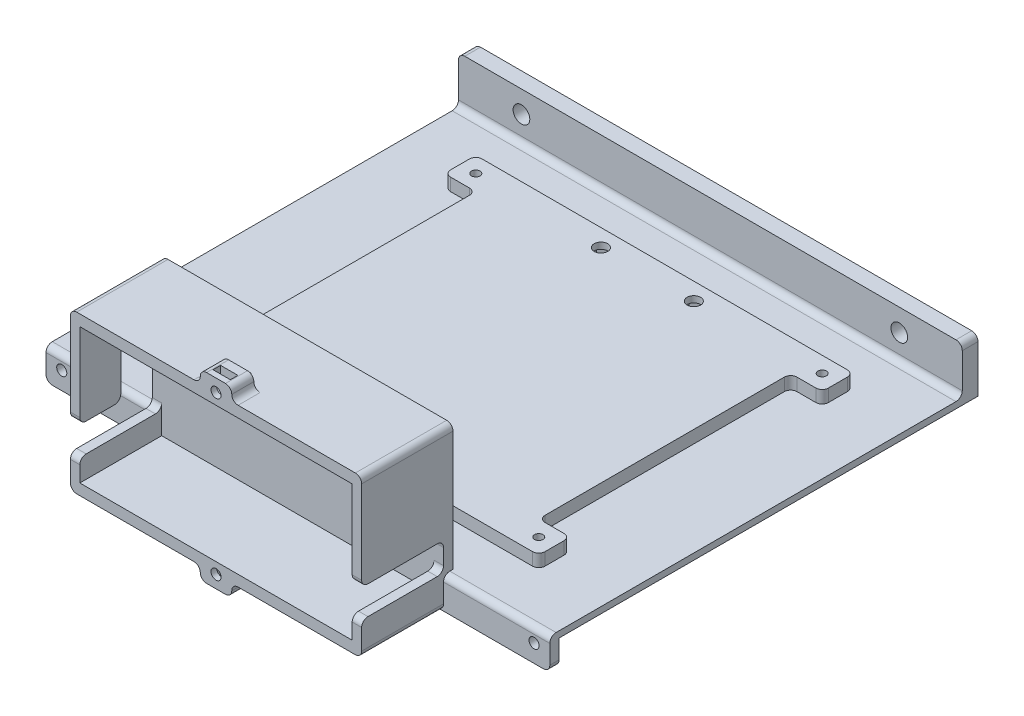
from build123d import *

# Parameters (mm, degrees)
SKETCH1_W                      = 160
SKETCH1_H                      = 133
BOSS_EXTRUDE1_DEPTH            = 2
SKETCH2_W                      = 160
SKETCH2_H                      = 10
BOSS_EXTRUDE2_DEPTH            = 3
M3_CLEARANCE_HOLE1_D           = 3.2
M3_CLEARANCE_HOLE1_DEPTH       = 12.4
M3_CLEARANCE_HOLE1_TIP         = 0.96137699
SKETCH5_W                      = 160
SKETCH5_H                      = 15
BOSS_EXTRUDE3_DEPTH            = 5
M5_CLEARANCE_HOLE1_D           = 5.3
M5_CLEARANCE_HOLE1_DEPTH       = 12.4
M5_CLEARANCE_HOLE1_TIP         = 1.59228064
BOSS_EXTRUDE4_DEPTH            = 4
M2_5_CLEARANCE_HOLE1_D         = 2.7
M4_CLEARANCE_HOLE1_D           = 4.3
CUT_EXTRUDE4_DEPTH             = 4
SKETCH13_W                     = 92.5
SKETCH13_H                     = 29
BOSS_EXTRUDE5_DEPTH            = 50
SKETCH14_W                     = 86.5
SKETCH14_H                     = 43
CUT_EXTRUDE1_DEPTH             = 26
SKETCH15_W                     = 10
SKETCH15_H                     = 4
BOSS_EXTRUDE6_DEPTH            = 7
F_3_2_3_2_DIAMETER_HOLE1_D     = 3.2
F_3_2_3_2_DIAMETER_HOLE1_DEPTH = 10
F_3_2_3_2_DIAMETER_HOLE1_TIP   = 0.96137699
CUT_EXTRUDE2_DEPTH             = 26
SKETCH21_W                     = 13
SKETCH21_H                     = 21
BOSS_EXTRUDE7_DEPTH            = 3
CUT_EXTRUDE3_DEPTH             = 1.2
FILLET1_R                      = 2


with BuildPart() as part:
    # Sketch1 → Boss-Extrude1 (new body)
    with BuildSketch(Plane(origin=(0, 0, 0), x_dir=(1, 0, 0), z_dir=(0, 1, 0))):
        Rectangle(SKETCH1_W, SKETCH1_H)
    extrude(amount=BOSS_EXTRUDE1_DEPTH)

    # Sketch2 → Boss-Extrude2 (add)
    with BuildSketch(Plane.XY.offset(66.5)):
        with Locations((0, -3)):
            Rectangle(SKETCH2_W, SKETCH2_H)
    extrude(amount=BOSS_EXTRUDE2_DEPTH)

    # M3 Clearance Hole1
    with Locations(Plane.XY.offset(69.5)):
        with Locations((-75, -2.38), (75, -2.38)):
            Hole(M3_CLEARANCE_HOLE1_D / 2, depth=M3_CLEARANCE_HOLE1_DEPTH)
            with Locations((0, 0, -(M3_CLEARANCE_HOLE1_DEPTH + M3_CLEARANCE_HOLE1_TIP / 2))):  # 118° drill point
                Cone(0, M3_CLEARANCE_HOLE1_D / 2, M3_CLEARANCE_HOLE1_TIP, mode=Mode.SUBTRACT)

    # Sketch5 → Boss-Extrude3 (add)
    with BuildSketch(Plane(origin=(0, 0, -66.5), x_dir=(-1, 0, 0), z_dir=(0, 0, -1))):
        with Locations((0, 9.5)):
            Rectangle(SKETCH5_W, SKETCH5_H)
    extrude(amount=-BOSS_EXTRUDE3_DEPTH)

    # M5 Clearance Hole1
    with Locations(Plane.XY.offset(-61.5)):
        with Locations((60, 10), (-60, 10)):
            Hole(M5_CLEARANCE_HOLE1_D / 2, depth=M5_CLEARANCE_HOLE1_DEPTH)
            with Locations((0, 0, -(M5_CLEARANCE_HOLE1_DEPTH + M5_CLEARANCE_HOLE1_TIP / 2))):  # 118° drill point
                Cone(0, M5_CLEARANCE_HOLE1_D / 2, M5_CLEARANCE_HOLE1_TIP, mode=Mode.SUBTRACT)

    # Sketch8 → Boss-Extrude4 (add)
    with BuildSketch(Plane(origin=(0, 2, 0), x_dir=(1, 0, 0), z_dir=(0, 1, 0))):
        Polygon((-50, 37), (-50, -43), (-60, -43), (-60, -53), (-50, -53), (50, -53), (60, -53), (60, -43), (50, -43), (50, 37), (60, 37), (60, 47), (50, 47), (-50, 47), (-60, 47), (-60, 37), align=None)
    extrude(amount=BOSS_EXTRUDE4_DEPTH)

    # M2.5 Clearance Hole1 (through all)
    with Locations(Plane(origin=(0, 6, 0), x_dir=(1, 0, 0), z_dir=(0, 1, 0))):
        with Locations((-55, 42), (55, 42), (55, -48), (-55, -48)):
            Hole(M2_5_CLEARANCE_HOLE1_D / 2)

    # M4 Clearance Hole1 (through all)
    with Locations(Plane(origin=(0, 6, 0), x_dir=(1, 0, 0), z_dir=(0, 1, 0))):
        with Locations((-14.75, 41.5), (14.75, 41.5), (-14.75, -47.5), (14.75, -47.5)):
            Hole(M4_CLEARANCE_HOLE1_D / 2)

    # Sketch25 → Cut-Extrude4 (cut)
    with BuildSketch(Plane(origin=(0, 0, 0), x_dir=(-1, 0, 0), z_dir=(0, -1, 0))):
        Polygon((55, -50.886751346), (57.5, -49.443375673), (57.5, -46.556624327), (55, -45.113248654), (52.5, -46.556624327), (52.5, -49.443375673), align=None)
        Polygon((-55, -50.886751346), (-52.5, -49.443375673), (-52.5, -46.556624327), (-55, -45.113248654), (-57.5, -46.556624327), (-57.5, -49.443375673), align=None)
        Polygon((-55, 39.113248654), (-52.5, 40.556624327), (-52.5, 43.443375673), (-55, 44.886751346), (-57.5, 43.443375673), (-57.5, 40.556624327), align=None)
        Polygon((55, 39.113248654), (57.5, 40.556624327), (57.5, 43.443375673), (55, 44.886751346), (52.5, 43.443375673), (52.5, 40.556624327), align=None)
        Polygon((-14.75, 45.541451884), (-18.25, 43.520725942), (-18.25, 39.479274058), (-14.75, 37.458548116), (-11.25, 39.479274058), (-11.25, 43.520725942), align=None)
        Polygon((14.75, 45.541451884), (11.25, 43.520725942), (11.25, 39.479274058), (14.75, 37.458548116), (18.25, 39.479274058), (18.25, 43.520725942), align=None)
        Polygon((14.75, -43.458548116), (11.25, -45.479274058), (11.25, -49.520725942), (14.75, -51.541451884), (18.25, -49.520725942), (18.25, -45.479274058), align=None)
        Polygon((-14.75, -43.458548116), (-18.25, -45.479274058), (-18.25, -49.520725942), (-14.75, -51.541451884), (-11.25, -49.520725942), (-11.25, -45.479274058), align=None)
    extrude(amount=-CUT_EXTRUDE4_DEPTH, mode=Mode.SUBTRACT)

    # Sketch13 → Boss-Extrude5 (add)
    with BuildSketch(Plane.XZ.offset(8)):
        with Locations((0, 81)):
            Rectangle(SKETCH13_W, SKETCH13_H)
    extrude(amount=-BOSS_EXTRUDE5_DEPTH)

    # Sketch14 → Cut-Extrude1 (cut)
    with BuildSketch(Plane.XY.offset(95.5)):
        with Locations((0, 17)):
            Rectangle(SKETCH14_W, SKETCH14_H)
    extrude(amount=-CUT_EXTRUDE1_DEPTH, mode=Mode.SUBTRACT)

    # Sketch15 → Boss-Extrude6 (add)
    with BuildSketch(Plane.XY.offset(95.5)):
        with Locations((0, 44)):
            Rectangle(SKETCH15_W, SKETCH15_H)
        with Locations((0, -10)):
            Rectangle(SKETCH15_W, SKETCH15_H)
    extrude(amount=-BOSS_EXTRUDE6_DEPTH)

    # Ø3.2 (3.2) Diameter Hole1
    with Locations(Plane.XY.offset(95.5)):
        with Locations((0, 42), (0, -8)):
            Hole(F_3_2_3_2_DIAMETER_HOLE1_D / 2, depth=F_3_2_3_2_DIAMETER_HOLE1_DEPTH)
            with Locations((0, 0, -(F_3_2_3_2_DIAMETER_HOLE1_DEPTH + F_3_2_3_2_DIAMETER_HOLE1_TIP / 2))):  # 118° drill point
                Cone(0, F_3_2_3_2_DIAMETER_HOLE1_D / 2, F_3_2_3_2_DIAMETER_HOLE1_TIP, mode=Mode.SUBTRACT)

    # Sketch20 → Cut-Extrude2 (cut)
    with BuildSketch(Plane.XY.offset(95.5)):
        Polygon((-46.25, 11.5), (-46.25, 2.5), (46.25, 2.5), (46.25, 11.5), (-43.25, 11.5), (-43.25, 32.5), (-46.25, 32.5), align=None)
    extrude(amount=-CUT_EXTRUDE2_DEPTH, mode=Mode.SUBTRACT)

    # Sketch21 → Boss-Extrude7 (add)
    with BuildSketch(Plane.ZY.offset(46.25)):
        with Locations((89, 22)):
            Rectangle(SKETCH21_W, SKETCH21_H)
    extrude(amount=-BOSS_EXTRUDE7_DEPTH)

    # Sketch22 → Cut-Extrude3 (cut, symmetric)
    with BuildSketch(Plane.XY.offset(92.5)):
        Polygon((-2.75, 43.58771324), (-2.75, 46), (2.75, 46), (2.75, 43.58771324), (2.75, 40.41228676), (0, 38.824573519), (-2.75, 40.41228676), align=None)
        Polygon((2.75, -9.58771324), (2.75, -6.41228676), (0, -4.824573519), (-2.75, -6.41228676), (-2.75, -9.58771324), (-2.75, -12), (2.75, -12), align=None)
    extrude(amount=CUT_EXTRUDE3_DEPTH, both=True, mode=Mode.SUBTRACT)

    # Fillet1
    fillet1_edges = [part.edges().sort_by_distance(p)[0] for p in [
        (-80, -8, 68),
        (80, -8, 68),
        (63.125, 2, 69.5),
        (-63.125, 2, 69.5),
        (-46.25, 42, 81),
        (46.25, 42, 81),
        (46.25, -8, 82.5),
        (-46.25, -8, 82.5),
        (-5, 42, 92),
        (-5, 46, 92),
        (5, 46, 92),
        (5, 42, 92),
        (5, -8, 92),
        (5, -12, 92),
        (-5, -12, 92),
        (-5, -8, 92),
        (44.75, 2.5, 95.5),
        (44.75, 11.5, 95.5),
        (-44.75, 2.5, 95.5),
        (44.75, 2.5, 69.5),
        (-44.75, 2.5, 69.5),
        (44.75, 11.5, 69.5),
        (-44.75, 32.5, 69.5),
        (80, 17, -64),
        (-80, 17, -64),
        (0, 2, -61.5),
        (-44.75, 11.5, 95.5),
        (-44.75, 11.5, 82.5),
        (-44.75, 32.5, 82.5),
        (60, 4, -47),
        (-60, 4, -47),
        (-60, 4, -37),
        (-50, 4, -37),
        (-50, 4, 43),
        (-60, 4, 43),
        (-60, 4, 53),
        (60, 4, 53),
        (60, 4, 43),
        (50, 4, 43),
        (50, 4, -37),
        (60, 4, -37),
    ]]
    fillet(fillet1_edges, radius=FILLET1_R - 0.0001)  # a hair under: the kernel refuses the full size


solid = part.part
